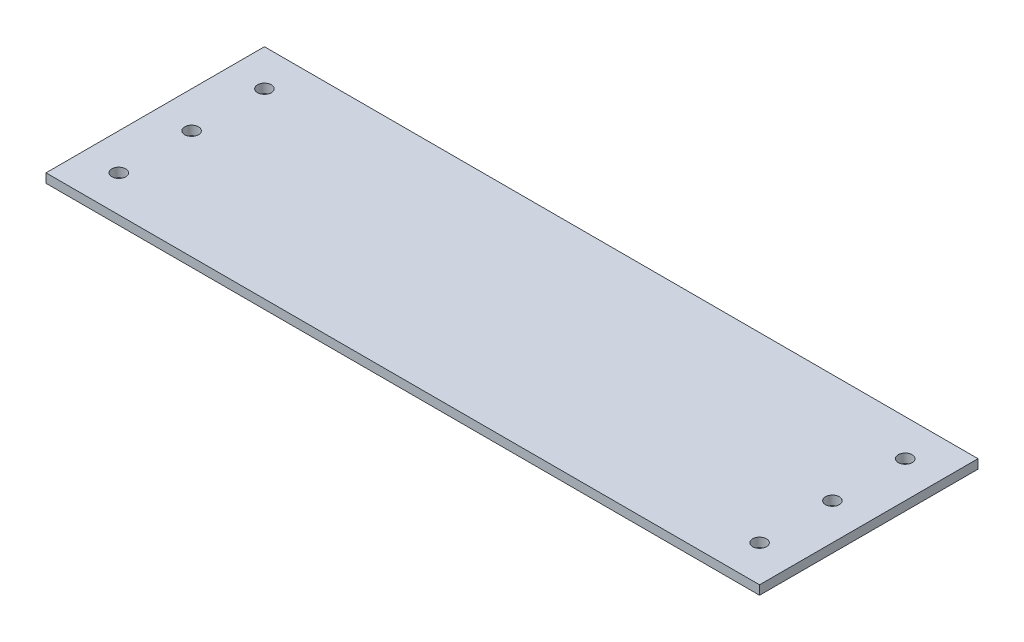
from build123d import *

# Parameters (mm, degrees)
SKETCH1_W           = 248.92
SKETCH1_H           = 76.2
SKETCH1_R           = 2.413
BOSS_EXTRUDE1_DEPTH = 3.175


with BuildPart() as part:
    # Sketch1 → Boss-Extrude1 (new body)
    with BuildSketch(Plane(origin=(0, 0, 0), x_dir=(1, 0, 0), z_dir=(0, 1, 0))):
        with Locations((124.46, 38.1)):
            Rectangle(SKETCH1_W, SKETCH1_H)
        with Locations((12.7, 63.5)):
            Circle(SKETCH1_R, mode=Mode.SUBTRACT)
        with Locations((12.7, 38.1)):
            Circle(SKETCH1_R, mode=Mode.SUBTRACT)
        with Locations((12.7, 12.7)):
            Circle(SKETCH1_R, mode=Mode.SUBTRACT)
        with Locations((236.22, 12.7)):
            Circle(SKETCH1_R, mode=Mode.SUBTRACT)
        with Locations((236.22, 38.1)):
            Circle(SKETCH1_R, mode=Mode.SUBTRACT)
        with Locations((236.22, 63.5)):
            Circle(SKETCH1_R, mode=Mode.SUBTRACT)
    extrude(amount=BOSS_EXTRUDE1_DEPTH)


solid = part.part
